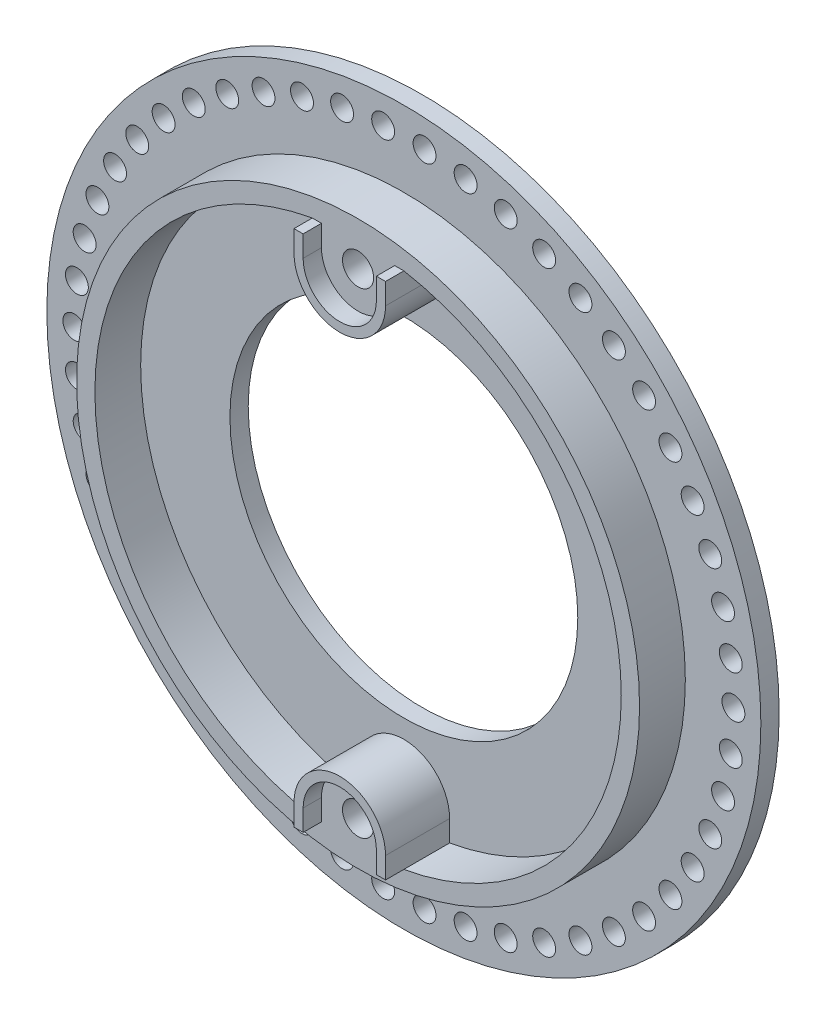
from build123d import *

# Parameters (mm, degrees)
SKETCH1_R           = 39
BOSS_EXTRUDE1_DEPTH = 2
SKETCH3_R           = 30.75
BOSS_EXTRUDE2_DEPTH = 5
SKETCH5_R           = 1.7
CUT_EXTRUDE2_DEPTH  = 7
SKETCH6_R           = 3
CUT_EXTRUDE3_DEPTH  = 4.5
SKETCH7_R           = 19
CUT_EXTRUDE4_DEPTH  = 2
SKETCH8_R           = 1.25
CUT_EXTRUDE5_DEPTH  = 2
FILLET1_R           = 1.5
BOSS_EXTRUDE3_DEPTH = 2


with BuildPart() as part:
    # Sketch1 → Boss-Extrude1 (new body)
    with BuildSketch(Plane.XY):
        Circle(SKETCH1_R)
    extrude(amount=BOSS_EXTRUDE1_DEPTH)

    # Sketch3 → Boss-Extrude2 (add)
    with BuildSketch(Plane.XY.offset(2)):
        Circle(SKETCH3_R)
        with BuildLine():
            Line((-5, 26), (-5, 28.311879132))
            ThreePointArc((-5, 28.311879132), (-28.75, 0), (-5, -28.311879132))
            Line((-5, -28.311879132), (-5, -26))
            ThreePointArc((-5, -26), (0, -21), (5, -26))
            Line((5, -26), (5, -28.311879132))
            ThreePointArc((5, -28.311879132), (28.75, 0), (5, 28.311879132))
            Line((5, 28.311879132), (5, 26))
            ThreePointArc((5, 26), (0, 21), (-5, 26))
        make_face(mode=Mode.SUBTRACT)
    extrude(amount=BOSS_EXTRUDE2_DEPTH)

    # Sketch5 → Cut-Extrude2 (cut)
    with BuildSketch(Plane.XY.offset(7)):
        with Locations((0, -26)):
            Circle(SKETCH5_R)
        with Locations((0, 26)):
            Circle(SKETCH5_R)
    extrude(amount=-CUT_EXTRUDE2_DEPTH, mode=Mode.SUBTRACT)

    # Sketch6 → Cut-Extrude3 (cut)
    with BuildSketch(Plane(origin=(0, 0, 0), x_dir=(-1, 0, 0), z_dir=(0, 0, -1))):
        with Locations((0, 26)):
            Circle(SKETCH6_R)
        with Locations((0, -26)):
            Circle(SKETCH6_R)
    extrude(amount=-CUT_EXTRUDE3_DEPTH, mode=Mode.SUBTRACT)

    # Sketch7 → Cut-Extrude4 (cut)
    with BuildSketch(Plane(origin=(0, 0, 0), x_dir=(-1, 0, 0), z_dir=(0, 0, -1))):
        Circle(SKETCH7_R)
    extrude(amount=-CUT_EXTRUDE4_DEPTH, mode=Mode.SUBTRACT)

    # Sketch8 → Cut-Extrude5 (cut)
    with BuildSketch(Plane.XY.offset(2)):
        with Locations((36, 0)):
            Circle(SKETCH8_R)
        with Locations((35.716129247, -4.511996408)):
            Circle(SKETCH8_R)
        with Locations((34.868993801, -8.952835938)):
            Circle(SKETCH8_R)
        with Locations((33.471953492, -13.252483897)):
            Circle(SKETCH8_R)
        with Locations((31.547040482, -17.343132268)):
            Circle(SKETCH8_R)
        with Locations((29.124611797, -21.160269083)):
            Circle(SKETCH8_R)
        with Locations((26.242870587, -24.643695813)):
            Circle(SKETCH8_R)
        with Locations((22.947263631, -27.73847674)):
            Circle(SKETCH8_R)
        with Locations((19.289764619, -30.395805318)):
            Circle(SKETCH8_R)
        with Locations((15.328054496, -32.573773889)):
            Circle(SKETCH8_R)
        with Locations((11.124611797, -34.238034587)):
            Circle(SKETCH8_R)
        with Locations((6.745727325, -35.362341026)):
            Circle(SKETCH8_R)
        with Locations((2.260458703, -35.928962223)):
            Circle(SKETCH8_R)
        with Locations((-2.260458703, -35.928962223)):
            Circle(SKETCH8_R)
        with Locations((-6.745727325, -35.362341026)):
            Circle(SKETCH8_R)
        with Locations((-11.124611797, -34.238034587)):
            Circle(SKETCH8_R)
        with Locations((-15.328054496, -32.573773889)):
            Circle(SKETCH8_R)
        with Locations((-19.289764619, -30.395805318)):
            Circle(SKETCH8_R)
        with Locations((-22.947263631, -27.73847674)):
            Circle(SKETCH8_R)
        with Locations((-26.242870587, -24.643695813)):
            Circle(SKETCH8_R)
        with Locations((-29.124611797, -21.160269083)):
            Circle(SKETCH8_R)
        with Locations((-31.547040482, -17.343132268)):
            Circle(SKETCH8_R)
        with Locations((-33.471953492, -13.252483897)):
            Circle(SKETCH8_R)
        with Locations((-34.868993801, -8.952835938)):
            Circle(SKETCH8_R)
        with Locations((-35.716129247, -4.511996408)):
            Circle(SKETCH8_R)
        with Locations((-36, 0)):
            Circle(SKETCH8_R)
        with Locations((-35.716129247, 4.511996408)):
            Circle(SKETCH8_R)
        with Locations((-34.868993801, 8.952835938)):
            Circle(SKETCH8_R)
        with Locations((-33.471953492, 13.252483897)):
            Circle(SKETCH8_R)
        with Locations((-31.547040482, 17.343132268)):
            Circle(SKETCH8_R)
        with Locations((-29.124611797, 21.160269083)):
            Circle(SKETCH8_R)
        with Locations((-26.242870587, 24.643695813)):
            Circle(SKETCH8_R)
        with Locations((-22.947263631, 27.73847674)):
            Circle(SKETCH8_R)
        with Locations((-19.289764619, 30.395805318)):
            Circle(SKETCH8_R)
        with Locations((-15.328054496, 32.573773889)):
            Circle(SKETCH8_R)
        with Locations((-11.124611797, 34.238034587)):
            Circle(SKETCH8_R)
        with Locations((-6.745727325, 35.362341026)):
            Circle(SKETCH8_R)
        with Locations((-2.260458703, 35.928962223)):
            Circle(SKETCH8_R)
        with Locations((2.260458703, 35.928962223)):
            Circle(SKETCH8_R)
        with Locations((6.745727325, 35.362341026)):
            Circle(SKETCH8_R)
        with Locations((11.124611797, 34.238034587)):
            Circle(SKETCH8_R)
        with Locations((15.328054496, 32.573773889)):
            Circle(SKETCH8_R)
        with Locations((19.289764619, 30.395805318)):
            Circle(SKETCH8_R)
        with Locations((22.947263631, 27.73847674)):
            Circle(SKETCH8_R)
        with Locations((26.242870587, 24.643695813)):
            Circle(SKETCH8_R)
        with Locations((29.124611797, 21.160269083)):
            Circle(SKETCH8_R)
        with Locations((31.547040482, 17.343132268)):
            Circle(SKETCH8_R)
        with Locations((33.471953492, 13.252483897)):
            Circle(SKETCH8_R)
        with Locations((34.868993801, 8.952835938)):
            Circle(SKETCH8_R)
        with Locations((35.716129247, 4.511996408)):
            Circle(SKETCH8_R)
    extrude(amount=-CUT_EXTRUDE5_DEPTH, mode=Mode.SUBTRACT)

    # Fillet1
    # the kernel refuses this fillet: 1.5 mm, written as the material it adds along each edge
    with BuildSketch(Plane(origin=(0, 26, 4.5), x_dir=(-1, 0, 0), z_dir=(0, -1, 0))) as fillet1_piece_1:
        with BuildLine():
            CenterArc((1.5, 1.486606875), FILLET1_R, 277.662255661, 82.337744339)
            Line((1.7, 0), (1.704, -0.029732137))
            ThreePointArc((1.704, -0.029732137), (2.35, -0.03), (3, -0.03))
            Line((3, -0.03), (3.03, 0))
            Line((3.03, 0), (3.03, 1.486606875))
            Line((3.03, 1.486606875), (3, 1.486606875))
        make_face()
    revolve(axis=Axis((0, 26, 4.5), (0, 0, -1)))
    with BuildSketch(Plane(origin=(0, -26, 4.5), x_dir=(-1, 0, 0), z_dir=(0, -1, 0))) as fillet1_piece_2:
        with BuildLine():
            CenterArc((1.5, 1.486606875), FILLET1_R, 277.662255661, 82.337744339)
            Line((1.7, 0), (1.704, -0.029732137))
            ThreePointArc((1.704, -0.029732137), (2.35, -0.03), (3, -0.03))
            Line((3, -0.03), (3.03, 0))
            Line((3.03, 0), (3.03, 1.486606875))
            Line((3.03, 1.486606875), (3, 1.486606875))
        make_face()
    revolve(axis=Axis((0, -26, 4.5), (0, 0, -1)))

    # Sketch9 → Boss-Extrude3 (add)
    with BuildSketch(Plane.XY.offset(7)):
        with BuildLine():
            Line((-4, 28.311879132), (-5, 28.311879132))
            Line((-5, 28.311879132), (-5, 26))
            ThreePointArc((-5, 26), (0, 21), (5, 26))
            Line((5, 26), (5, 28.311879132))
            Line((5, 28.311879132), (4, 28.311879132))
            Line((4, 28.311879132), (4, 26))
            ThreePointArc((4, 26), (0, 22), (-4, 26))
            Line((-4, 26), (-4, 28.311879132))
        make_face()
        with BuildLine():
            Line((-5, -26), (-5, -28.311879132))
            Line((-5, -28.311879132), (-4, -28.311879132))
            Line((-4, -28.311879132), (-4, -26))
            ThreePointArc((-4, -26), (0, -22), (4, -26))
            Line((4, -26), (4, -28.311879132))
            Line((4, -28.311879132), (5, -28.311879132))
            Line((5, -28.311879132), (5, -26))
            ThreePointArc((5, -26), (0, -21), (-5, -26))
        make_face()
    extrude(amount=BOSS_EXTRUDE3_DEPTH)


solid = part.part
